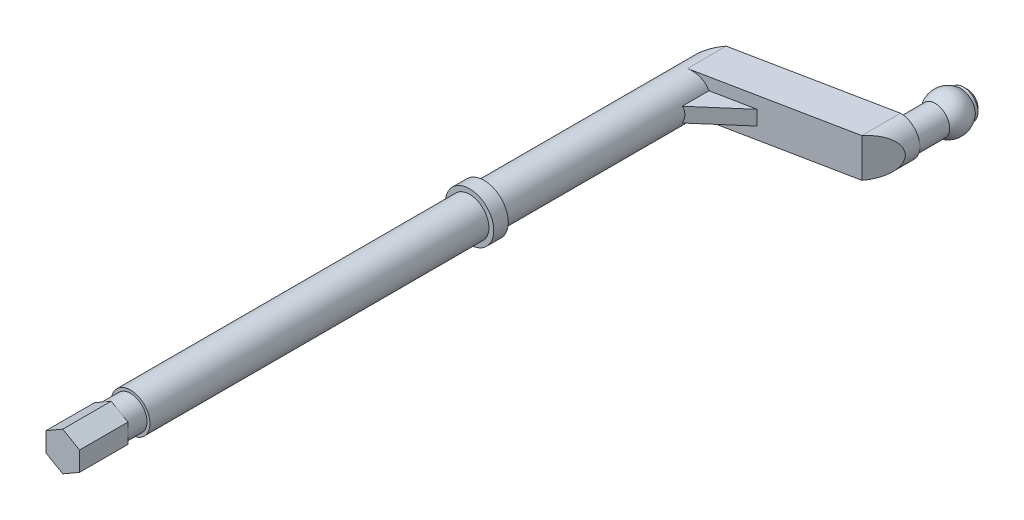
from build123d import *
from build123d.topology import SkipClean

# Parameters (mm, degrees)
SKETCH_1_R                  = 2
EXTRUDE_1_DEPTH             = 61.5
EXTRUDE_START               = -35
SKETCH_2_R                  = 2.5
EXTRUDE_2_DEPTH             = 1.5
SKETCH_3_R                  = 1.7
EXTRUDE_3_DEPTH             = 2
EXTRUDE_4_DEPTH             = 5
SKETCH_5_R                  = 2
EXTRUDE_5_DEPTH             = 4
EXTRUDE_6_DEPTH             = 2
EXTRUDE_6_DEPTH_BACK        = 2
CUT_EXTRUDE_1_REACH         = 72.721
SKETCH_8_R                  = 1.5
EXTRUDE_7_DEPTH             = 6.5
EXTRUDE_7_DIRECTION_2_REACH = 75.536
CHAMFER_1_SIZE              = 0.4
EXTRUDE_8_DEPTH             = 0.75
EXTRUDE_8_DEPTH_BACK        = 0.75


with BuildPart() as part:
    # 草图1 → 凸台-拉伸1 (new body)
    with BuildSketch(Plane.XY):
        Circle(SKETCH_1_R)
    extrude(amount=EXTRUDE_1_DEPTH)

    # 草图2 → 凸台-拉伸2 (add)
    with BuildSketch(Plane.XY.offset(61.5).offset(EXTRUDE_START)):
        Circle(SKETCH_2_R)
    extrude(amount=-EXTRUDE_2_DEPTH)

    # 草图3 → 凸台-拉伸3 (add)
    with BuildSketch(Plane.XY.offset(61.5)):
        Circle(SKETCH_3_R)
    extrude(amount=EXTRUDE_3_DEPTH)

    # 草图4 → 凸台-拉伸4 (add)
    with BuildSketch(Plane.XY.offset(63.5)):
        Polygon((0, 2), (-1.732050808, 1), (-1.732050808, -1), (0, -2), (1.732050808, -1), (1.732050808, 1), align=None)
    extrude(amount=EXTRUDE_4_DEPTH)



with BuildPart() as body_2:
    # 草图5 → 凸台-拉伸5 (new body)
    with BuildSketch(Plane(origin=(0, 0, 1), x_dir=(-1, 0, 0), z_dir=(0, 0, -1))):
        with Locations((-15, 0)):
            Circle(SKETCH_5_R)
    extrude(amount=EXTRUDE_5_DEPTH)


with BuildPart() as part_1:
    add(part.part)

    add(body_2.part)  # 凸台-拉伸6 merges body 2
    # 草图6 → 凸台-拉伸6 (add, two sides: drawn at the far end of the back side and taken through both)
    with BuildSketch(Plane(origin=(0, 0, 0), x_dir=(1, 0, 0), z_dir=(0, 1, 0)).offset(-EXTRUDE_6_DEPTH_BACK)):
        Polygon((0, 0), (15, 3), (15, -1), (0, -4), align=None)
    extrude(amount=EXTRUDE_6_DEPTH + EXTRUDE_6_DEPTH_BACK)

    # 草图7 → 切除-拉伸1 (cut, up to next)
    with BuildSketch(Plane(origin=(0, 2, 0), x_dir=(1, 0, 0), z_dir=(0, 1, 0)), mode=Mode.PRIVATE) as cut_extrude_1_sk1:
        Polygon((0, 0), (-2, 0), (-2, -2.5), align=None)
    cut_extrude_1_tool1 = extrude(cut_extrude_1_sk1.sketch, amount=-CUT_EXTRUDE_1_REACH, mode=Mode.PRIVATE) & part_1.part
    # 草图7 → 切除-拉伸1 (cut, up to next)
    with BuildSketch(Plane(origin=(0, 2, 0), x_dir=(1, 0, 0), z_dir=(0, 1, 0)), mode=Mode.PRIVATE) as cut_extrude_1_sk2:
        Polygon((15, -1), (17, 1.5), (17, -1), align=None)
    cut_extrude_1_tool2 = extrude(cut_extrude_1_sk2.sketch, amount=-CUT_EXTRUDE_1_REACH, mode=Mode.PRIVATE) & part_1.part
    # 草图7 → 切除-拉伸1 (cut, up to next)
    with BuildSketch(Plane(origin=(0, 2, 0), x_dir=(1, 0, 0), z_dir=(0, 1, 0)), mode=Mode.PRIVATE) as cut_extrude_1_sk3:
        Polygon((15, 3), (13, 2.6), (13, 3), align=None)
    cut_extrude_1_tool3 = extrude(cut_extrude_1_sk3.sketch, amount=-CUT_EXTRUDE_1_REACH, mode=Mode.PRIVATE) & part_1.part
    add(cut_extrude_1_tool1.solids().sort_by_distance((-1.333333, 2, 0.833333))[0], mode=Mode.SUBTRACT)
    add(cut_extrude_1_tool2.solids().sort_by_distance((16.333333, 2, 0.166667))[0], mode=Mode.SUBTRACT)
    add(cut_extrude_1_tool3.solids().sort_by_distance((13.666667, 2, -2.866667))[0], mode=Mode.SUBTRACT)

    # 草图8 → 凸台-拉伸7 (add)
    with BuildSketch(Plane(origin=(0, 0, -3), x_dir=(-1, 0, 0), z_dir=(0, 0, -1))):
        with Locations((-15.4, 0)):
            Circle(SKETCH_8_R)
    extrude(amount=EXTRUDE_7_DEPTH)

    # 草图8 → 凸台-拉伸7 direction 2 (add, up to next)
    with BuildSketch(Plane(origin=(0, 0, -3), x_dir=(-1, 0, 0), z_dir=(0, 0, -1)), mode=Mode.PRIVATE) as extrude_7_direction_2_sk1:
        with Locations((-15.4, 0)):
            Circle(SKETCH_8_R)
    extrude_7_direction_2_tool1 = extrude(extrude_7_direction_2_sk1.sketch, amount=-EXTRUDE_7_DIRECTION_2_REACH, mode=Mode.PRIVATE) - part_1.part
    add(extrude_7_direction_2_tool1.solids().sort_by_distance((15.4, 0, -3))[0])

    # 草图9 → 旋转1 (revolve)
    with SkipClean():  # the faces are left unmerged after this step: merging them gives an invalid solid
        with BuildSketch(Plane(origin=(0, 0, 0), x_dir=(1, 0, 0), z_dir=(0, 1, 0))):
            with BuildLine():
                Line((15.4, 9.5), (15.4, 7.5))
                Line((15.4, 7.5), (15.4, 5.5))
                ThreePointArc((15.4, 5.5), (17.4, 7.5), (15.4, 9.5))
            make_face()
        revolve(axis=Axis((15.4, 0, -9.5), (0, 0, 1)))
    add(part_1.part.scale(1), mode=Mode.REPLACE)  # the faces are merged on a copy

    # 倒角1
    chamfer_1_edges = [part_1.edges().sort_by_distance(p)[0] for p in [
        (16.9, 0, -9.5),
    ]]
    chamfer(chamfer_1_edges, length=CHAMFER_1_SIZE)

    # 草图10 → 凸台-拉伸8 (add, two sides: drawn at the far end of the back side and taken through both)
    with SkipClean():  # the faces are left unmerged after this step: merging them gives an invalid solid
        with BuildSketch(Plane(origin=(0, 0, 0), x_dir=(1, 0, 0), z_dir=(0, 1, 0)).offset(-EXTRUDE_8_DEPTH_BACK)):
            Polygon((0, -2), (0, -8), (6, -2.8), (8, -1.066666667), align=None)
        extrude(amount=EXTRUDE_8_DEPTH + EXTRUDE_8_DEPTH_BACK)


solid = part_1.part
